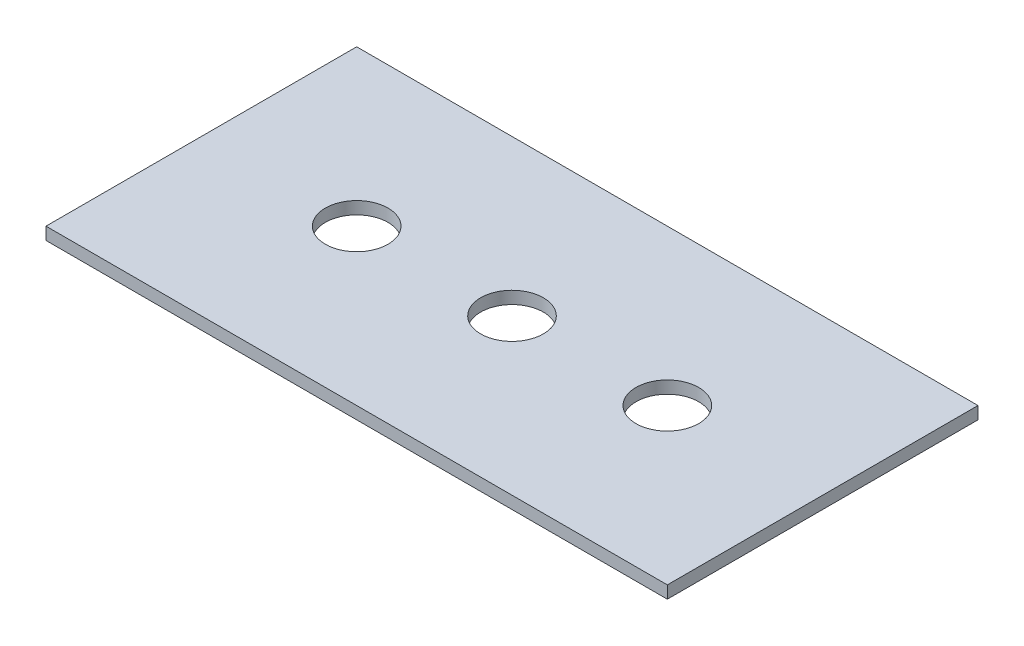
from build123d import *

# Parameters (mm, degrees)
SKETCH1_W            = 101.6
SKETCH1_H            = 50.8
BOSS_EXTRUDE1_DEPTH  = 2.032
SKETCH2_R            = 5.127000033
CUT_EXTRUDE1_DEPTH   = 57.832464525
LPATTERN1_COUNT      = 2
LPATTERN1_PITCH      = 25.4
LPATTERN1_COUNT_DIR2 = 2
LPATTERN1_PITCH_DIR2 = 25.4


with BuildPart() as part:
    # Sketch1 → Boss-Extrude1 (new body)
    with BuildSketch(Plane(origin=(0, 0, 0), x_dir=(1, 0, 0), z_dir=(0, 1, 0))):
        Rectangle(SKETCH1_W, SKETCH1_H)
    extrude(amount=BOSS_EXTRUDE1_DEPTH)

    # Sketch2 → Cut-Extrude1 (cut, through all)
    with BuildSketch(Plane(origin=(0, 2.032, 0), x_dir=(1, 0, 0), z_dir=(0, 1, 0))):
        Circle(SKETCH2_R)
    cut_extrude1 = extrude(amount=-CUT_EXTRUDE1_DEPTH, mode=Mode.SUBTRACT)

    # LPattern1: Cut-Extrude1 2 × 2
    with Locations(*[Vector(-1, 0, 0) * (i * LPATTERN1_PITCH) + Vector(1, 0, 0) * (j * LPATTERN1_PITCH_DIR2) for i in range(LPATTERN1_COUNT) for j in range(LPATTERN1_COUNT_DIR2) if (i, j) != (0, 0)]):
        add(cut_extrude1, mode=Mode.SUBTRACT)


solid = part.part
